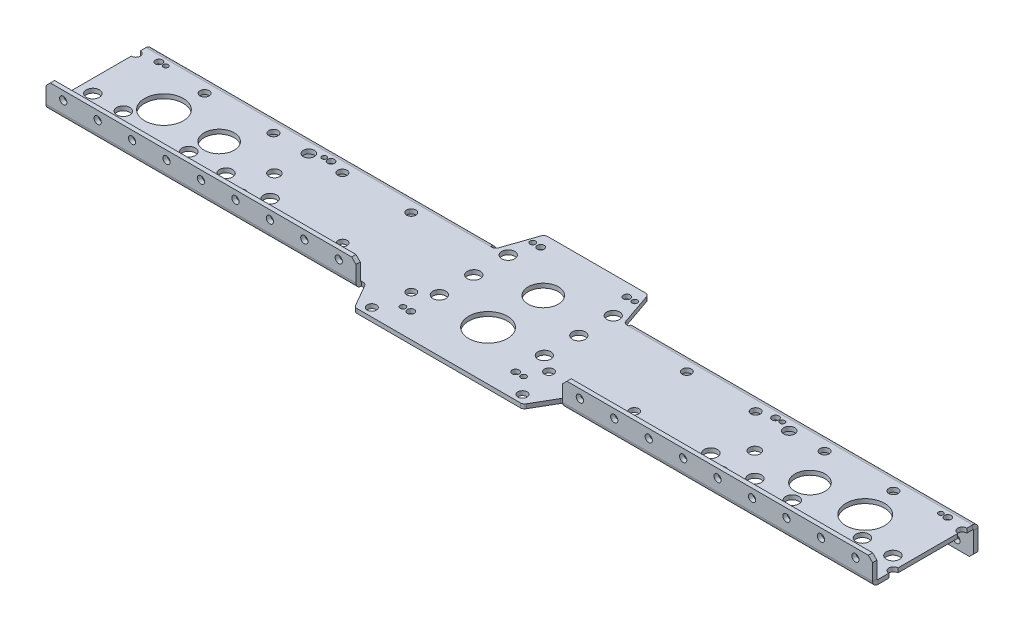
from build123d import *

# Parameters (mm, degrees)
SKETCH1_W                  = 812.8
SKETCH1_H                  = 69.85
BOSS_EXTRUDE1_DEPTH        = 3.175
SKETCH3_R                  = 14.2875
CUT_EXTRUDE1_DEPTH         = 816.802024467
EDGE_FLANGE1_DEPTH         = 812.8
EDGE_FLANGE2_DEPTH         = 812.8
SKETCH10_R                 = 4.826
LONG_6WD_DEPTH             = 817.444922817
SKETCH11_R                 = 4.826
SHORT_6WD_DEPTH            = 817.444922817
SKETCH12_R                 = 3.3528
F_8WD_EGG_DEPTH            = 817.444922817
SKETCH14_R                 = 2.667
UPPER_FLANGE_HP_DEPTH      = 817.729920277
SKETCH16_R                 = 2.667
LOWER_FLANGE_HP_DEPTH      = 817.433889486
LPATTERN1_COUNT            = 32
LPATTERN1_PITCH            = 25.4
SKETCH17_W                 = 152.4
SKETCH17_H                 = 6.35
CUT_EXTRUDE9_DEPTH         = 818.031193633
SKETCH18_W                 = 146.05
SKETCH18_H                 = 3.175
BOSS_EXTRUDE2_DEPTH        = 19.05
SKETCH19_W                 = 101.6
SKETCH19_H                 = 3.937
CUT_EXTRUDE10_DEPTH        = 818.031193633
SKETCH20_W                 = 95.25
SKETCH20_H                 = 3.175
BOSS_EXTRUDE3_DEPTH        = 27.432
CUT_EXTRUDE14_DEPTH        = 819.902667079
SKETCH21_R                 = 11.1125
SKETCH21_R_2               = 4.7625
SKETCH21_R_3               = 2.54
SKETCH21_R_4               = 2.032
TB_MINI_SHAFT_PLATE_DEPTH  = 819.8226487
CUT_EXTRUDE12_DEPTH        = 819.8226487
SKETCH26_R                 = 3.4036
SONIC_MOUNTING_HOLES_DEPTH = 819.902667079
SKETCH29_R                 = 2.5527
SKETCH29_R_2               = 1.7859375
SKETCH29_R_3               = 14.2875
SKETCH29_R_4               = 11.1125
SKETCH29_R_5               = 4.064
TB_MICRO_MOUNTING_DEPTH    = 819.902667079
FILLET1_R                  = 3.175
CHAMFER1_SIZE              = 3.175
SKETCH34_R                 = 3.3782
CUT_EXTRUDE17_DEPTH        = 819.902667079
SKETCH35_W                 = 101.6
SKETCH35_H                 = 77.724
CUT_EXTRUDE18_DEPTH        = 820.487179597
CHAMFER3_SIZE              = 3.175


# Sheet-metal steps are written as plain solids
with BuildPart() as part:
    # Sketch1 → Boss-Extrude1 (new body)
    with BuildSketch(Plane(origin=(0, 0, 0), x_dir=(1, 0, 0), z_dir=(0, 1, 0))):
        with Locations((406.4, 34.925)):
            Rectangle(SKETCH1_W, SKETCH1_H)
    extrude(amount=BOSS_EXTRUDE1_DEPTH)

    # Sketch3 → Cut-Extrude1 (cut, through all)
    with BuildSketch(Plane(origin=(0, 3.175, 0), x_dir=(1, 0, 0), z_dir=(0, 1, 0))):
        with Locations(Location((406.4, 17.272, 0), (0, 0, 270))):
            Circle(SKETCH3_R)
    extrude(amount=-CUT_EXTRUDE1_DEPTH, mode=Mode.SUBTRACT)

    # Edge-Flange1 section (across the edge) → Edge-Flange1 (add)
    with BuildSketch(Plane(origin=(0, 3.175, 0.762), x_dir=(0, 0, -1), z_dir=(1, 0, 0))):
        with BuildLine():
            Line((-3.175, 0.762), (-3.175, 15.875))
            Line((-3.175, 15.875), (0, 15.875))
            Line((0, 15.875), (0, 0.762))
            ThreePointArc((0, 0.762), (0.223184633, 0.223184633), (0.762, 0))
            Line((0.762, 0), (0.762, -3.175))
            ThreePointArc((0.762, -3.175), (-2.021879398, -2.021879398), (-3.175, 0.762))
        make_face()
    extrude(amount=EDGE_FLANGE1_DEPTH)

    # Edge-Flange2 section (across the edge) → Edge-Flange2 (add)
    with BuildSketch(Plane(origin=(0, 0, -70.612), x_dir=(0, 0, 1), z_dir=(1, 0, 0))):
        with BuildLine():
            Line((-3.175, 0.762), (-3.175, 19.05))
            Line((-3.175, 19.05), (0, 19.05))
            Line((0, 19.05), (0, 0.762))
            ThreePointArc((0, 0.762), (0.223184633, 0.223184633), (0.762, 0))
            Line((0.762, 0), (0.762, -3.175))
            ThreePointArc((0.762, -3.175), (-2.021879398, -2.021879398), (-3.175, 0.762))
        make_face()
    extrude(amount=EDGE_FLANGE2_DEPTH)

    # Sketch10 → Long 6wd (cut, through all)
    with BuildSketch(Plane(origin=(0, 3.175, 0), x_dir=(1, 0, 0), z_dir=(0, 1, 0))):
        with Locations(Location((86.339113657, 20.828, 0), (0, 0, 270))):
            Circle(SKETCH10_R)
        with Locations(Location((111.349627997, 20.828, 0), (0, 0, 270))):
            Circle(SKETCH10_R)
        with Locations(Location((133.855797334, 20.828, 0), (0, 0, 270))):
            Circle(SKETCH10_R)
        with Locations(Location((726.460886343, 20.828, 0), (0, 0, 270))):
            Circle(SKETCH10_R)
        with Locations(Location((701.450372003, 20.828, 0), (0, 0, 270))):
            Circle(SKETCH10_R)
        with Locations(Location((678.944202666, 20.828, 0), (0, 0, 270))):
            Circle(SKETCH10_R)
    extrude(amount=-LONG_6WD_DEPTH, mode=Mode.SUBTRACT)

    # Sketch11 → Short 6wd (cut, through all)
    with BuildSketch(Plane(origin=(0, 3.175, 0), x_dir=(1, 0, 0), z_dir=(0, 1, 0))):
        with Locations(Location((183.852302373, 19.05, 0), (0, 0, 270))):
            Circle(SKETCH11_R)
        with Locations(Location((211.361504088, 19.05, 0), (0, 0, 270))):
            Circle(SKETCH11_R)
        with Locations(Location((243.875125248, 19.05, 0), (0, 0, 270))):
            Circle(SKETCH11_R)
        with Locations(Location((568.924874752, 19.05, 0), (0, 0, 270))):
            Circle(SKETCH11_R)
        with Locations(Location((601.438495912, 19.05, 0), (0, 0, 270))):
            Circle(SKETCH11_R)
        with Locations(Location((628.947697627, 19.05, 0), (0, 0, 270))):
            Circle(SKETCH11_R)
    extrude(amount=-SHORT_6WD_DEPTH, mode=Mode.SUBTRACT)

    # Sketch12 → 8wd egg (cut, through all)
    with BuildSketch(Plane(origin=(0, 3.175, 0), x_dir=(1, 0, 0), z_dir=(0, 1, 0))):
        with Locations(Location((298.874532383, 17.547282407, 0), (0, 0, 270))):
            Circle(SKETCH12_R)
        with Locations(Location((513.925467617, 17.547282407, 0), (0, 0, 270))):
            Circle(SKETCH12_R)
    extrude(amount=-F_8WD_EGG_DEPTH, mode=Mode.SUBTRACT)

    # Sketch14 → upper flange HP (cut, through all)
    with BuildSketch(Plane(origin=(0, 0, -73.787), x_dir=(-1, 0, 0), z_dir=(0, 0, -1))):
        with Locations(Location((-12.7, -12.7, 0), (0, 0, 90))):
            Circle(SKETCH14_R)
        with Locations(Location((-38.1, -12.7, 0), (0, 0, 90))):
            Circle(SKETCH14_R)
        with Locations(Location((-63.5, -12.7, 0), (0, 0, 90))):
            Circle(SKETCH14_R)
        with Locations(Location((-88.9, -12.7, 0), (0, 0, 90))):
            Circle(SKETCH14_R)
        with Locations(Location((-114.3, -12.7, 0), (0, 0, 90))):
            Circle(SKETCH14_R)
        with Locations(Location((-139.7, -12.7, 0), (0, 0, 90))):
            Circle(SKETCH14_R)
        with Locations(Location((-165.1, -12.7, 0), (0, 0, 90))):
            Circle(SKETCH14_R)
        with Locations(Location((-190.5, -12.7, 0), (0, 0, 90))):
            Circle(SKETCH14_R)
        with Locations(Location((-215.9, -12.7, 0), (0, 0, 90))):
            Circle(SKETCH14_R)
        with Locations(Location((-241.3, -12.7, 0), (0, 0, 90))):
            Circle(SKETCH14_R)
        with Locations(Location((-266.7, -12.7, 0), (0, 0, 90))):
            Circle(SKETCH14_R)
        with Locations(Location((-292.1, -12.7, 0), (0, 0, 90))):
            Circle(SKETCH14_R)
        with Locations(Location((-317.5, -12.7, 0), (0, 0, 90))):
            Circle(SKETCH14_R)
        with Locations(Location((-342.9, -12.7, 0), (0, 0, 90))):
            Circle(SKETCH14_R)
        with Locations(Location((-368.3, -12.7, 0), (0, 0, 90))):
            Circle(SKETCH14_R)
        with Locations(Location((-393.7, -12.7, 0), (0, 0, 90))):
            Circle(SKETCH14_R)
        with Locations(Location((-419.1, -12.7, 0), (0, 0, 90))):
            Circle(SKETCH14_R)
        with Locations(Location((-444.5, -12.7, 0), (0, 0, 90))):
            Circle(SKETCH14_R)
        with Locations(Location((-469.9, -12.7, 0), (0, 0, 90))):
            Circle(SKETCH14_R)
        with Locations(Location((-495.3, -12.7, 0), (0, 0, 90))):
            Circle(SKETCH14_R)
        with Locations(Location((-520.7, -12.7, 0), (0, 0, 90))):
            Circle(SKETCH14_R)
        with Locations(Location((-546.1, -12.7, 0), (0, 0, 90))):
            Circle(SKETCH14_R)
        with Locations(Location((-571.5, -12.7, 0), (0, 0, 90))):
            Circle(SKETCH14_R)
        with Locations(Location((-596.9, -12.7, 0), (0, 0, 90))):
            Circle(SKETCH14_R)
        with Locations(Location((-622.3, -12.7, 0), (0, 0, 90))):
            Circle(SKETCH14_R)
        with Locations(Location((-647.7, -12.7, 0), (0, 0, 90))):
            Circle(SKETCH14_R)
        with Locations(Location((-673.1, -12.7, 0), (0, 0, 90))):
            Circle(SKETCH14_R)
        with Locations(Location((-698.5, -12.7, 0), (0, 0, 90))):
            Circle(SKETCH14_R)
        with Locations(Location((-723.9, -12.7, 0), (0, 0, 90))):
            Circle(SKETCH14_R)
        with Locations(Location((-749.3, -12.7, 0), (0, 0, 90))):
            Circle(SKETCH14_R)
        with Locations(Location((-774.7, -12.7, 0), (0, 0, 90))):
            Circle(SKETCH14_R)
        with Locations(Location((-800.1, -12.7, 0), (0, 0, 90))):
            Circle(SKETCH14_R)
    extrude(amount=-UPPER_FLANGE_HP_DEPTH, mode=Mode.SUBTRACT)

    # Sketch16 → Lower flange HP (cut, through all)
    with BuildSketch(Plane(origin=(0, 0, 0.762), x_dir=(-1, 0, 0), z_dir=(0, 0, -1))):
        with Locations(Location((-12.7, 12.7, 0), (0, 0, 90))):
            Circle(SKETCH16_R)
    lower_flange_hp = extrude(amount=-LOWER_FLANGE_HP_DEPTH, mode=Mode.SUBTRACT)

    # LPattern1: Lower flange HP ×32
    with Locations(*[(i * LPATTERN1_PITCH, 0, 0) for i in range(1, LPATTERN1_COUNT)]):
        add(lower_flange_hp, mode=Mode.SUBTRACT)

    # Sketch17 → Cut-Extrude9 (cut, through all)
    with BuildSketch(Plane(origin=(0, 19.05, 0), x_dir=(1, 0, 0), z_dir=(0, 1, 0))):
        with Locations((406.4, -3.175)):
            Rectangle(SKETCH17_W, SKETCH17_H)
    extrude(amount=-CUT_EXTRUDE9_DEPTH, mode=Mode.SUBTRACT)

    # Sketch18 → Boss-Extrude2 (add)
    with BuildSketch(Plane.XY):
        with Locations((406.4, 1.5875)):
            Rectangle(SKETCH18_W, SKETCH18_H)
    extrude(amount=BOSS_EXTRUDE2_DEPTH)

    # Sketch19 → Cut-Extrude10 (cut, through all)
    with BuildSketch(Plane.XZ.offset(19.05)):
        with Locations((406.4, -71.8185)):
            Rectangle(SKETCH19_W, SKETCH19_H)
    extrude(amount=-CUT_EXTRUDE10_DEPTH, mode=Mode.SUBTRACT)

    # Sketch20 → Boss-Extrude3 (add)
    with BuildSketch(Plane(origin=(0, 0, -69.85), x_dir=(-1, 0, 0), z_dir=(0, 0, -1))):
        with Locations((-406.4, 1.5875)):
            Rectangle(SKETCH20_W, SKETCH20_H)
    extrude(amount=BOSS_EXTRUDE3_DEPTH)

    # Sketch27 → Cut-Extrude14 (cut, through all)
    with BuildSketch(Plane(origin=(0, 3.175, 0), x_dir=(1, 0, 0), z_dir=(0, 1, 0))):
        Polygon((333.375, 0), (344.373522628, -19.05), (333.375, -19.05), align=None)
        Polygon((479.425, 0), (479.425, -19.05), (468.426477372, -19.05), align=None)
    extrude(amount=-CUT_EXTRUDE14_DEPTH, mode=Mode.SUBTRACT)

    # Sketch21 → TB Mini Shaft plate (cut, through all)
    with BuildSketch(Plane.XZ):
        with Locations(Location((406.4, -57.9628, 0), (0, 0, 270))):
            Circle(SKETCH21_R)
        with Locations(Location((445.12429721, -45.466, 0), (0, 0, 270))):
            Circle(SKETCH21_R_2)
        with Locations(Location((367.67570279, -45.466, 0), (0, 0, 270))):
            Circle(SKETCH21_R_2)
        with Locations(Location((445.12429721, -70.866, 0), (0, 0, 270))):
            Circle(SKETCH21_R_2)
        with Locations(Location((445.12429721, -20.066, 0), (0, 0, 270))):
            Circle(SKETCH21_R_2)
        with Locations(Location((367.67570279, -20.066, 0), (0, 0, 270))):
            Circle(SKETCH21_R_2)
        with Locations(Location((367.67570279, -70.866, 0), (0, 0, 270))):
            Circle(SKETCH21_R_2)
        with Locations(Location((438.15, -87.85352, 0), (0, 0, 270))):
            Circle(SKETCH21_R_3)
        with Locations(Location((374.65, -87.85352, 0), (0, 0, 270))):
            Circle(SKETCH21_R_3)
        with Locations(Location((443.992, -87.85352, 0), (0, 0, 270))):
            Circle(SKETCH21_R_4)
        with Locations(Location((368.808, -87.85352, 0), (0, 0, 270))):
            Circle(SKETCH21_R_4)
        with Locations(Location((445.0461, 1.03886, 0), (0, 0, 270))):
            Circle(SKETCH21_R_3)
        with Locations(Location((367.7539, 1.03886, 0), (0, 0, 270))):
            Circle(SKETCH21_R_3)
        with Locations(Location((361.9119, 1.03886, 0), (0, 0, 270))):
            Circle(SKETCH21_R_4)
        with Locations(Location((450.8881, 1.03886, 0), (0, 0, 270))):
            Circle(SKETCH21_R_4)
    extrude(amount=-TB_MINI_SHAFT_PLATE_DEPTH, mode=Mode.SUBTRACT)

    # Sketch22 → Cut-Extrude12 (cut, through all)
    with BuildSketch(Plane.XZ):
        Polygon((454.025, -69.85), (444.579404912, -97.282), (454.025, -97.282), align=None)
        Polygon((358.775, -69.85), (368.220595088, -97.282), (358.775, -97.282), align=None)
    extrude(amount=-CUT_EXTRUDE12_DEPTH, mode=Mode.SUBTRACT)

    # Sketch26 → Sonic mounting holes (cut, through all)
    with BuildSketch(Plane(origin=(0, 3.175, 0), x_dir=(1, 0, 0), z_dir=(0, 1, 0))):
        with Locations(Location((350.8375, -12.8905, 0), (0, 0, 270))):
            Circle(SKETCH26_R)
        with Locations(Location((461.9625, -12.8905, 0), (0, 0, 270))):
            Circle(SKETCH26_R)
    extrude(amount=-SONIC_MOUNTING_HOLES_DEPTH, mode=Mode.SUBTRACT)

    # Sketch29 → TB Micro Mounting (cut, through all)
    with BuildSketch(Plane(origin=(0, 3.175, 0), x_dir=(1, 0, 0), z_dir=(0, 1, 0))):
        with Locations(Location((115.520362832, 65.405, 0), (0, 0, 270))):
            Circle(SKETCH29_R)
        with Locations(Location((120.600362832, 65.405, 0), (0, 0, 270))):
            Circle(SKETCH29_R_2)
        with Locations(Location((147.829162832, 36.83, 0), (0, 0, 270))):
            Circle(SKETCH29_R_3)
        with Locations(Location((115.520362832, 8.255, 0), (0, 0, 270))):
            Circle(SKETCH29_R)
        with Locations(Location((120.600362832, 8.255, 0), (0, 0, 270))):
            Circle(SKETCH29_R_2)
        with Locations(Location((188.545362832, 36.83, 0), (0, 0, 270))):
            Circle(SKETCH29_R_4)
        with Locations(Location((229.261562832, 36.83, 0), (0, 0, 270))):
            Circle(SKETCH29_R_5)
        with Locations(Location((229.261562832, 62.23, 0), (0, 0, 270))):
            Circle(SKETCH29_R_5)
        with Locations(Location((229.261562832, 11.43, 0), (0, 0, 270))):
            Circle(SKETCH29_R_5)
        with Locations(Location((237.440362832, 8.255, 0), (0, 0, 270))):
            Circle(SKETCH29_R_2)
        with Locations(Location((242.520362832, 8.255, 0), (0, 0, 270))):
            Circle(SKETCH29_R)
        with Locations(Location((237.440362832, 65.405, 0), (0, 0, 270))):
            Circle(SKETCH29_R_2)
        with Locations(Location((242.520362832, 65.405, 0), (0, 0, 270))):
            Circle(SKETCH29_R)
        with Locations(Location((570.279637168, 65.405, 0), (0, 0, 270))):
            Circle(SKETCH29_R)
        with Locations(Location((575.359637168, 65.405, 0), (0, 0, 270))):
            Circle(SKETCH29_R_2)
        with Locations(Location((583.538437168, 62.23, 0), (0, 0, 270))):
            Circle(SKETCH29_R_5)
        with Locations(Location((583.538437168, 36.83, 0), (0, 0, 270))):
            Circle(SKETCH29_R_5)
        with Locations(Location((624.254637168, 36.83, 0), (0, 0, 270))):
            Circle(SKETCH29_R_4)
        with Locations(Location((570.279637168, 8.255, 0), (0, 0, 270))):
            Circle(SKETCH29_R)
        with Locations(Location((575.359637168, 8.255, 0), (0, 0, 270))):
            Circle(SKETCH29_R_2)
        with Locations(Location((583.538437168, 11.43, 0), (0, 0, 270))):
            Circle(SKETCH29_R_5)
        with Locations(Location((664.970837168, 36.83, 0), (0, 0, 270))):
            Circle(SKETCH29_R_3)
        with Locations(Location((692.199637168, 65.405, 0), (0, 0, 270))):
            Circle(SKETCH29_R_2)
        with Locations(Location((697.279637168, 65.405, 0), (0, 0, 270))):
            Circle(SKETCH29_R)
        with Locations(Location((692.199637168, 8.255, 0), (0, 0, 270))):
            Circle(SKETCH29_R_2)
        with Locations(Location((697.279637168, 8.255, 0), (0, 0, 270))):
            Circle(SKETCH29_R)
    extrude(amount=-TB_MICRO_MOUNTING_DEPTH, mode=Mode.SUBTRACT)

    # Fillet1
    fillet1_edges = [part.edges().sort_by_distance(p)[0] for p in [
        (333.375, 1.5875, 0),
        (479.425, 1.5875, 0),
        (454.025, 1.5875, -69.85),
        (358.775, 1.5875, -69.85),
        (468.426477372, 1.5875, 19.05),
        (344.373522628, 1.5875, 19.05),
        (368.220595088, 1.5875, -97.282),
        (444.579404912, 1.5875, -97.282),
    ]]
    fillet(fillet1_edges, radius=FILLET1_R)

    # Chamfer1
    chamfer1_edges = [part.edges().sort_by_distance(p)[0] for p in [
        (0, 19.05, 2.3495),
        (812.8, 19.05, 2.3495),
        (0, -19.05, -72.1995),
        (482.6, 19.05, 2.3495),
        (330.2, 19.05, 2.3495),
        (812.8, -19.05, -72.1995),
        (355.6, -19.05, -72.1995),
        (457.2, -19.05, -72.1995),
    ]]
    chamfer(chamfer1_edges, length=CHAMFER1_SIZE)

    # Sketch34 → Cut-Extrude17 (cut, through all)
    with BuildSketch(Plane(origin=(0, 3.175, 0), x_dir=(1, 0, 0), z_dir=(0, 1, 0))):
        with Locations(Location((50.8, 11.43, 0), (0, 0, 270))):
            Circle(SKETCH34_R)
        with Locations(Location((50.8, 62.23, 0), (0, 0, 270))):
            Circle(SKETCH34_R)
        with Locations(Location((101.6, 62.23, 0), (0, 0, 270))):
            Circle(SKETCH34_R)
        with Locations(Location((101.6, 11.43, 0), (0, 0, 270))):
            Circle(SKETCH34_R)
        with Locations(Location((152.4, 62.23, 0), (0, 0, 270))):
            Circle(SKETCH34_R)
        with Locations(Location((152.4, 11.43, 0), (0, 0, 270))):
            Circle(SKETCH34_R)
        with Locations(Location((203.2, 62.23, 0), (0, 0, 270))):
            Circle(SKETCH34_R)
        with Locations(Location((203.2, 11.43, 0), (0, 0, 270))):
            Circle(SKETCH34_R)
        with Locations(Location((254, 62.23, 0), (0, 0, 270))):
            Circle(SKETCH34_R)
        with Locations(Location((254, 11.43, 0), (0, 0, 270))):
            Circle(SKETCH34_R)
        with Locations(Location((304.8, 62.23, 0), (0, 0, 270))):
            Circle(SKETCH34_R)
        with Locations(Location((355.6, 11.43, 0), (0, 0, 270))):
            Circle(SKETCH34_R)
        with Locations(Location((457.2, 11.43, 0), (0, 0, 270))):
            Circle(SKETCH34_R)
        with Locations(Location((508, 62.23, 0), (0, 0, 270))):
            Circle(SKETCH34_R)
        with Locations(Location((558.8, 62.23, 0), (0, 0, 270))):
            Circle(SKETCH34_R)
        with Locations(Location((558.8, 11.43, 0), (0, 0, 270))):
            Circle(SKETCH34_R)
        with Locations(Location((609.6, 62.23, 0), (0, 0, 270))):
            Circle(SKETCH34_R)
        with Locations(Location((609.6, 11.43, 0), (0, 0, 270))):
            Circle(SKETCH34_R)
        with Locations(Location((660.4, 62.23, 0), (0, 0, 270))):
            Circle(SKETCH34_R)
        with Locations(Location((660.4, 11.43, 0), (0, 0, 270))):
            Circle(SKETCH34_R)
        with Locations(Location((711.2, 62.23, 0), (0, 0, 270))):
            Circle(SKETCH34_R)
        with Locations(Location((711.2, 11.43, 0), (0, 0, 270))):
            Circle(SKETCH34_R)
        with Locations(Location((762, 62.23, 0), (0, 0, 270))):
            Circle(SKETCH34_R)
        with Locations(Location((762, 11.43, 0), (0, 0, 270))):
            Circle(SKETCH34_R)
    extrude(amount=-CUT_EXTRUDE17_DEPTH, mode=Mode.SUBTRACT)

    # Sketch35 → Cut-Extrude18 (cut, through all)
    with BuildSketch(Plane(origin=(0, 19.05, 0), x_dir=(1, 0, 0), z_dir=(0, 1, 0))):
        with Locations((50.8, 34.925)):
            Rectangle(SKETCH35_W, SKETCH35_H)
        with Locations((762, 34.925)):
            Rectangle(SKETCH35_W, SKETCH35_H)
    extrude(amount=-CUT_EXTRUDE18_DEPTH, mode=Mode.SUBTRACT)

    # Chamfer3
    chamfer3_edges = [part.edges().sort_by_distance(p)[0] for p in [
        (711.2, 19.05, 2.3495),
        (711.2, -19.05, -72.1995),
        (101.6, -19.05, -72.1995),
        (101.6, 19.05, 2.3495),
    ]]
    chamfer(chamfer3_edges, length=CHAMFER3_SIZE)


solid = part.part
